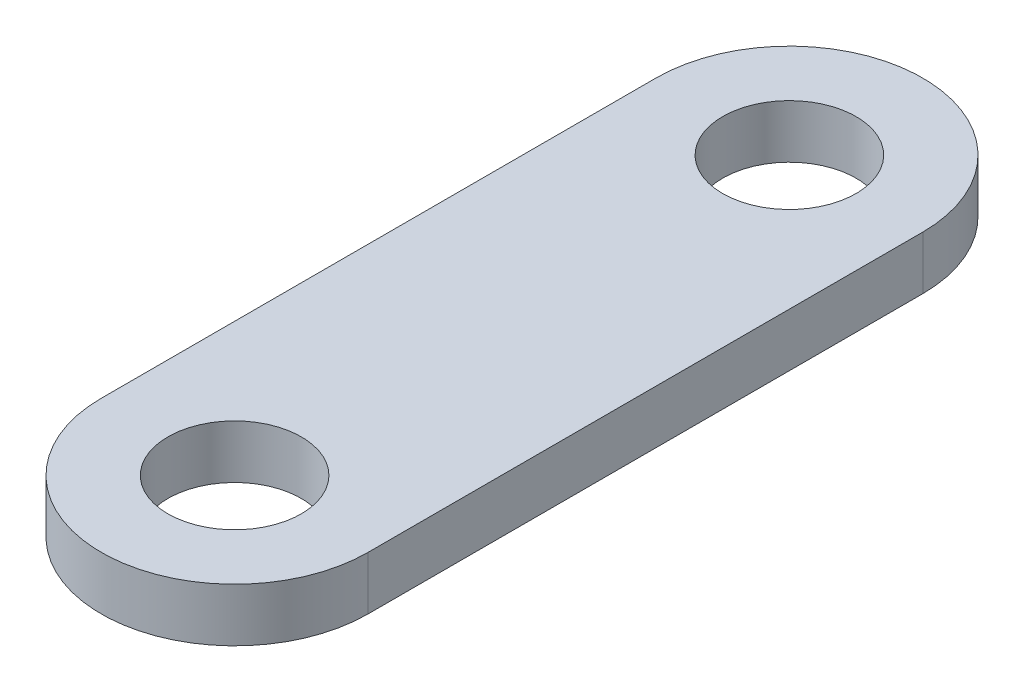
from build123d import *

# Parameters (mm, degrees)
SKETCH1_R          = 2.5
BASE_FLANGE1_DEPTH = 2


# Sheet-metal steps are written as plain solids
with BuildPart() as part:
    # Sketch1 → Base-Flange1 (new body)
    with BuildSketch(Plane(origin=(0, 0, 0), x_dir=(1, 0, 0), z_dir=(0, 1, 0))):
        with BuildLine():
            Line((5, -10.395), (5, 10.395))
            ThreePointArc((5, 10.395), (0, 15.395), (-5, 10.395))
            Line((-5, 10.395), (-5, -10.395))
            ThreePointArc((-5, -10.395), (0, -15.395), (5, -10.395))
        make_face()
        with Locations(Location((0, 10.395, 0), (0, 0, 270))):
            Circle(SKETCH1_R, mode=Mode.SUBTRACT)
        with Locations(Location((0, -10.395, 0), (0, 0, 270))):
            Circle(SKETCH1_R, mode=Mode.SUBTRACT)
    extrude(amount=-BASE_FLANGE1_DEPTH)


solid = part.part
